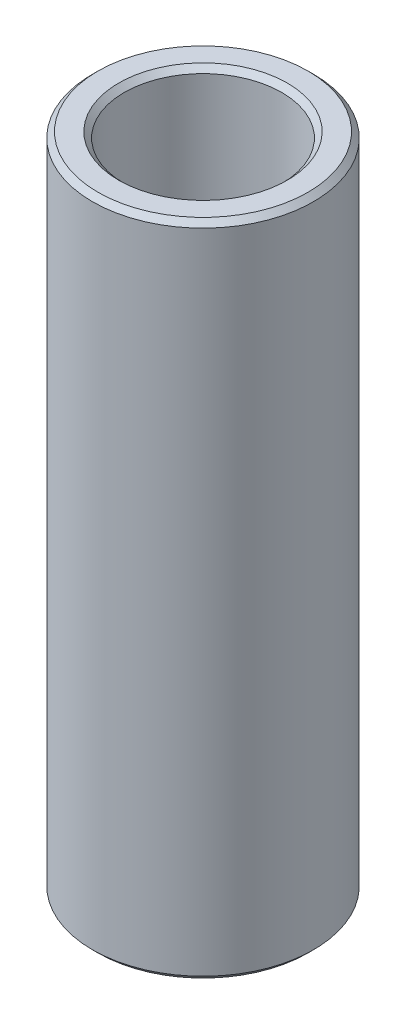
from build123d import *

# Parameters (mm, degrees)
SKETCH1_R           = 12.5
BOSS_EXTRUDE1_DEPTH = 74.525023218
SKETCH2_R           = 8.915626347
CUT_EXTRUDE1_DEPTH  = 77.592944098
CHAMFER1_SIZE       = 0.618013125


with BuildPart() as part:
    # Sketch1 → Boss-Extrude1 (new body)
    with BuildSketch(Plane(origin=(0, 0, 0), x_dir=(1, 0, 0), z_dir=(0, 1, 0))):
        Circle(SKETCH1_R)
    extrude(amount=BOSS_EXTRUDE1_DEPTH)

    # Sketch2 → Cut-Extrude1 (cut, through all)
    with BuildSketch(Plane(origin=(0, 0, 0), x_dir=(1, 0, 0), z_dir=(0, 1, 0))):
        Circle(SKETCH2_R)
    extrude(amount=CUT_EXTRUDE1_DEPTH, mode=Mode.SUBTRACT)

    # Chamfer1
    chamfer1_edges = [part.edges().sort_by_distance(p)[0] for p in [
        (-8.915626347, 74.525023218, 0),
        (-8.915626347, 0, 0),
        (-12.5, 0, 0),
        (-12.5, 74.525023218, 0),
    ]]
    chamfer(chamfer1_edges, length=CHAMFER1_SIZE)


solid = part.part
